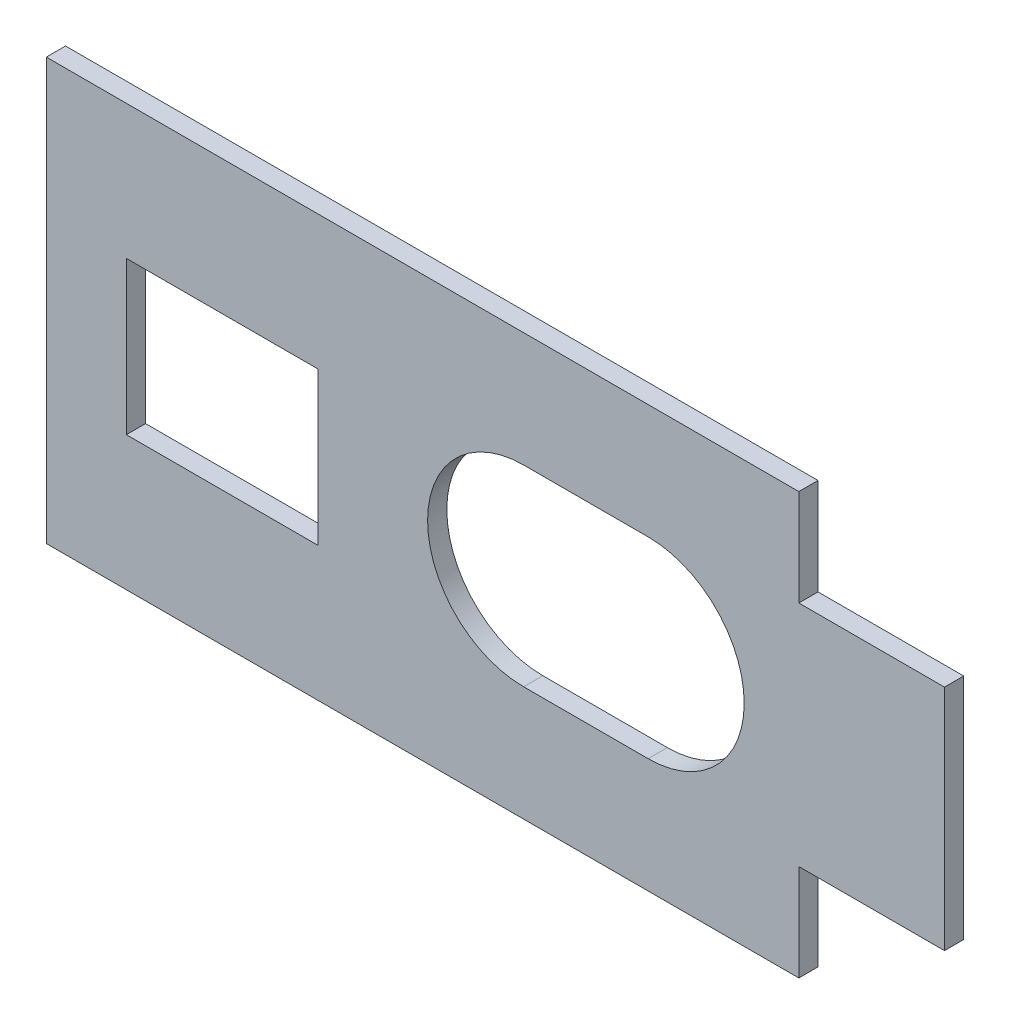
from build123d import *

# Parameters (mm, degrees)
SKETCH1_W           = 7.5946
SKETCH1_H           = 6.0579
BOSS_EXTRUDE2_DEPTH = 0.762


with BuildPart() as part:
    # Sketch1 → Boss-Extrude2 (new body)
    with BuildSketch(Plane.XY.offset(0.762)):
        Polygon((15.708264401, -19.1309), (-14.145149968, -19.1309), (-14.145149968, -35.8441), (15.708264401, -35.8441), (15.708264401, -32.01505), (21.486764401, -32.01505), (21.486764401, -22.95995), (15.708264401, -22.95995), align=None)
        with BuildLine():
            Line((9.730850032, -31.2975), (4.790550032, -31.2975))
            ThreePointArc((4.790550032, -31.2975), (0.980550032, -27.4875), (4.790550032, -23.6775))
            Line((4.790550032, -23.6775), (9.730850032, -23.6775))
            ThreePointArc((9.730850032, -23.6775), (13.540850032, -27.4875), (9.730850032, -31.2975))
        make_face(mode=Mode.SUBTRACT)
        with Locations((-7.172849968, -27.4875)):
            Rectangle(SKETCH1_W, SKETCH1_H, mode=Mode.SUBTRACT)
    extrude(amount=BOSS_EXTRUDE2_DEPTH)


solid = part.part
